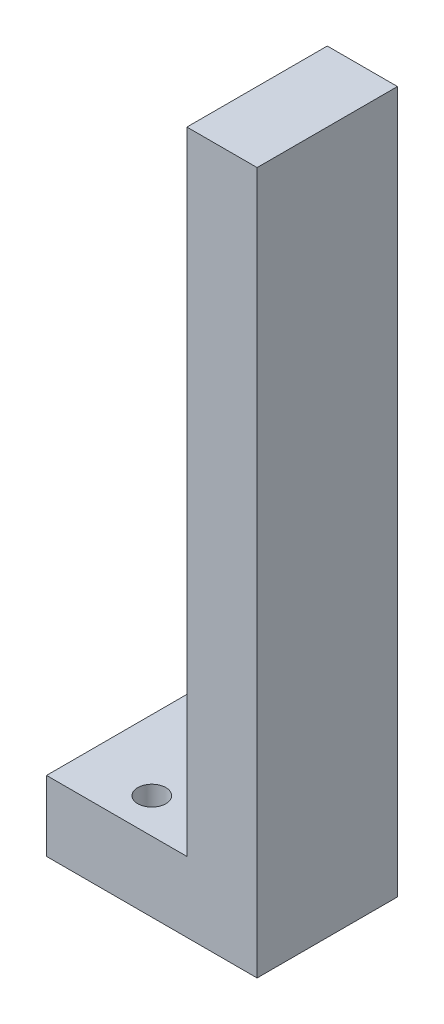
from build123d import *

# Parameters (mm, degrees)
SKETCH1_W           = 5
SKETCH1_H           = 50
BOSS_EXTRUDE1_DEPTH = 5
SKETCH2_W           = 10
SKETCH2_H           = 5
BOSS_EXTRUDE2_DEPTH = 10
SKETCH3_R           = 1
CUT_EXTRUDE1_DEPTH  = 47.97073557


with BuildPart() as part:
    # Sketch1 → Boss-Extrude1 (new, symmetric)
    with BuildSketch(Plane.XY):
        Rectangle(SKETCH1_W, SKETCH1_H)
    extrude(amount=BOSS_EXTRUDE1_DEPTH, both=True)

    # Sketch2 → Boss-Extrude2 (add)
    with BuildSketch(Plane.ZY.offset(2.5)):
        with Locations((0, -22.5)):
            Rectangle(SKETCH2_W, SKETCH2_H)
    extrude(amount=BOSS_EXTRUDE2_DEPTH)

    # Sketch3 → Cut-Extrude1 (cut, through all)
    with BuildSketch(Plane(origin=(0, -20, 0), x_dir=(1, 0, 0), z_dir=(0, 1, 0))):
        with Locations((-7.5, 2.5)):
            Circle(SKETCH3_R)
        with Locations((-7.5, -2.5)):
            Circle(SKETCH3_R)
    extrude(amount=-CUT_EXTRUDE1_DEPTH, mode=Mode.SUBTRACT)


solid = part.part
